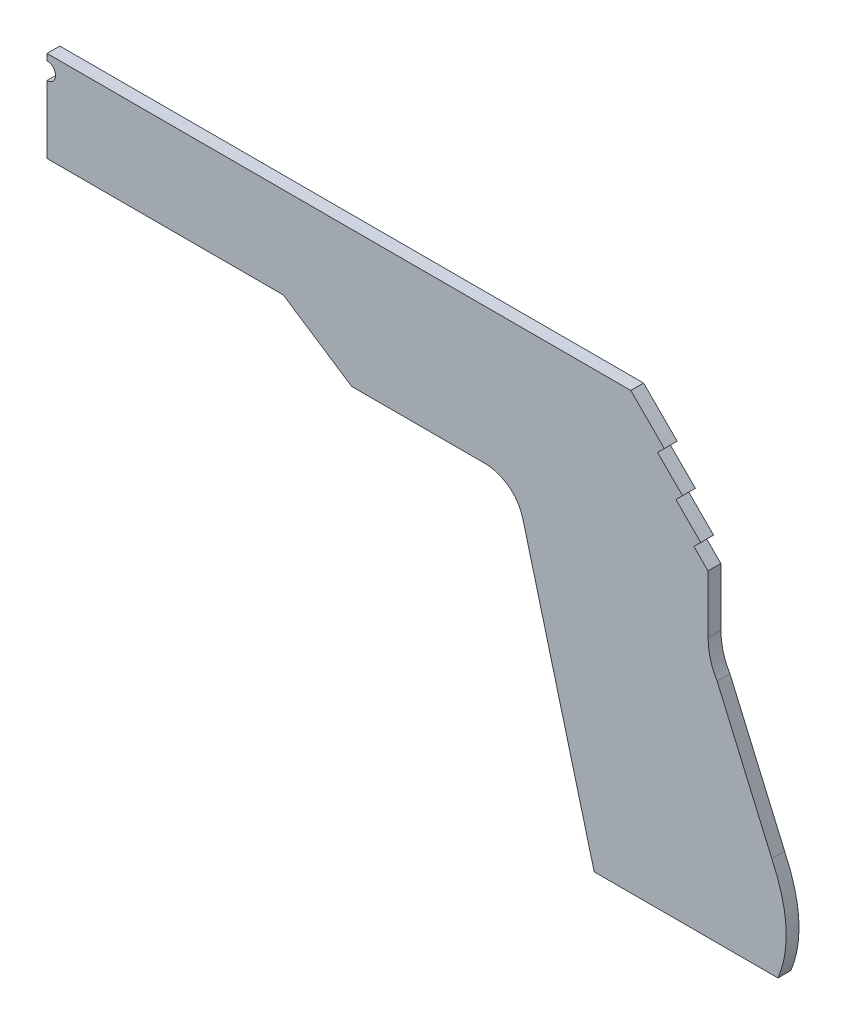
from build123d import *

# Parameters (mm, degrees)
BOSS_EXTRUDE2_DEPTH = 30


with BuildPart() as part:
    # Sketch1 → Boss-Extrude2 (new body)
    with BuildSketch(Plane.XY):
        with BuildLine():
            Line((1910.558216162, -97.92070529), (544.558216162, -97.92070529))
            Line((544.558216162, -97.92070529), (544.558216162, -112.92070529))
            ThreePointArc((544.558216162, -112.92070529), (564.558216162, -132.92070529), (544.558216162, -152.92070529))
            Line((544.558216162, -152.92070529), (544.558216162, -310.92070529))
            Line((544.558216162, -310.92070529), (1097.558216162, -310.92070529))
            Line((1097.558216162, -310.92070529), (1257.558216162, -416.348932942))
            Line((1257.558216162, -416.348932942), (1572.558216162, -416.348932942))
            add(Edge.make_bspline(
                [(1620.63909377, -432.150950072), (1597.867422333, -417.486858803), (1572.558216162, -416.348932942)],
                knots=[0, 0, 0, 1, 1, 1], degree=2))
            add(Edge.make_bspline(
                [(1658.575129115, -486.314340755), (1649.04543515, -450.083408952), (1620.63909377, -432.150950072)],
                knots=[0, 0, 0, 1, 1, 1], degree=2))
            Line((1658.575129115, -486.314340755), (1824.999431001, -1116.314340755))
            Line((1824.999431001, -1116.314340755), (2254.999430606, -1116.332765244))
            add(Edge.make_bspline(
                [(2240.542738795, -881.639882206), (2299.760407594, -1007.530078985), (2254.999430606, -1116.332765244)],
                knots=[0, 0, 0, 1, 1, 1], degree=2))
            Line((2240.542738795, -881.639882206), (2112.45741131, -585.639882206))
            add(Edge.make_bspline(
                [(2091.425555028, -508.224392479), (2091.540869536, -551.466322247), (2112.45741131, -585.639882206)],
                knots=[0, 0, 0, 0.973234405, 0.973234405, 0.973234405], degree=2))
            Line((2091.425555028, -508.224392479), (2091.425555028, -373.224392479))
            Line((2091.425555028, -373.224392479), (2058.338236007, -340.137073458))
            Line((2058.338236007, -340.137073458), (2074.318930336, -324.156379128))
            Line((2074.318930336, -324.156379128), (2016.212522227, -266.04997102))
            Line((2016.212522227, -266.04997102), (2031.665324835, -250.597168411))
            Line((2031.665324835, -250.597168411), (1973.297264366, -192.229107942))
            Line((1973.297264366, -192.229107942), (1989.081941591, -176.444430718))
            Line((1989.081941591, -176.444430718), (1910.558216162, -97.92070529))
        make_face()
    extrude(amount=BOSS_EXTRUDE2_DEPTH)


solid = part.part
